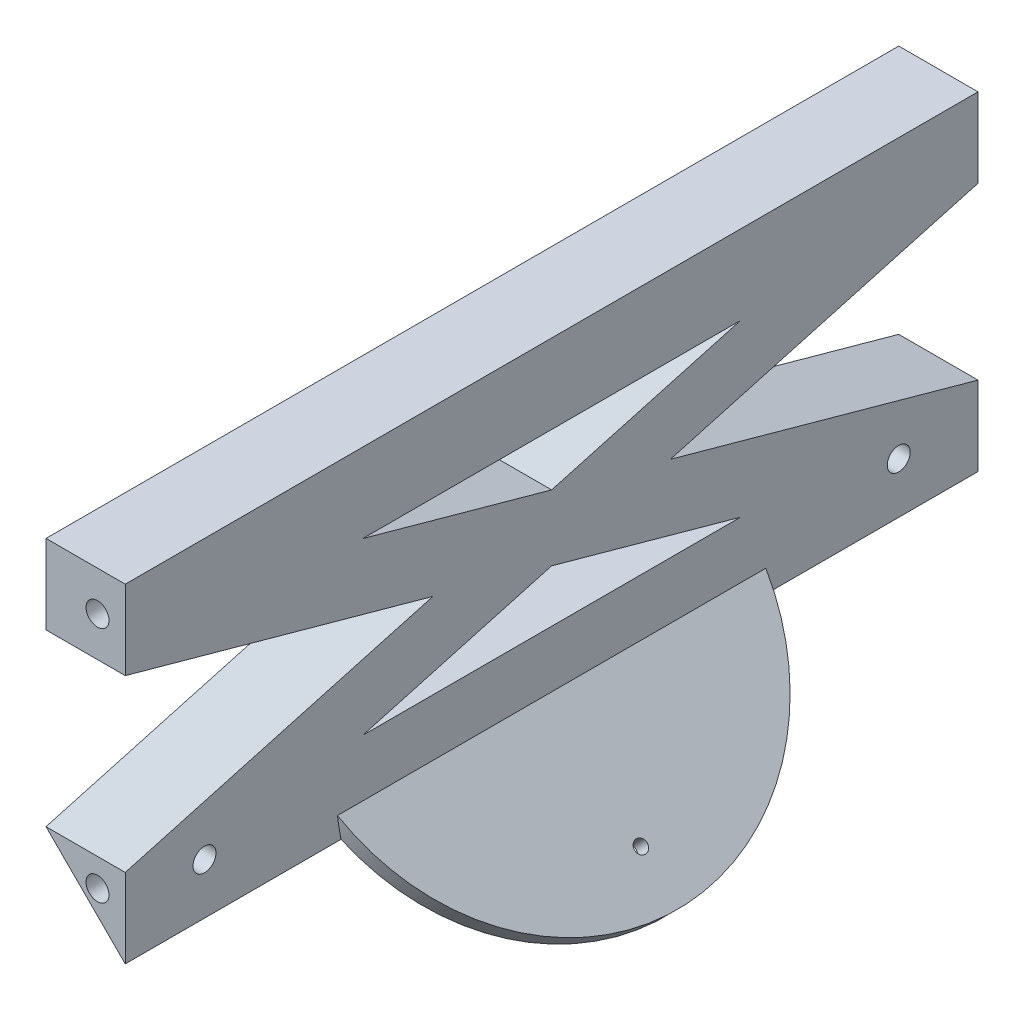
from build123d import *

# Parameters (mm, degrees)
MAIN_BODY_DEPTH        = 53.8
SKETCH4_W              = 35
SKETCH4_H              = 10.428932188
SKETCH4_H_2            = 14.142135624
BOSS_EXTRUDE2_DEPTH    = 2
M2X0_4_TAPPED_HOLE2_D  = 1.6
SIDE_HOLES_D           = 2.9
FILLET1_R              = 0.5
BOSS_EXTRUDE4_START    = -10
BOSS_EXTRUDE4_DEPTH    = 10
M2_5_CLEARANCE_HOLE1_D = 2.9
M2_5_CLEARANCE_HOLE2_D = 2.9


# Read off the part's stored shape, not the designer's step: Boss-Extrude4
with BuildPart() as part:
    # Sketch1 → Main Body (new, symmetric)
    with BuildSketch(Plane.XY):
        Polygon((-7.5, 2.5), (2.5, 2.5), (2.5, -7.5), align=None)
    extrude(amount=MAIN_BODY_DEPTH, both=True)

    # Sketch4 → Boss-Extrude2 (add)
    with BuildSketch(Plane(origin=(-2.5, -2.5, 0), x_dir=(0, 0, 1), z_dir=(-0.7071067811865474, -0.7071067811865477, 0))):
        with Locations((0, 12.285533906)):
            Rectangle(SKETCH4_W, SKETCH4_H)
        Rectangle(SKETCH4_W, SKETCH4_H_2)
        with Locations((0, -12.285533906)):
            Rectangle(SKETCH4_W, SKETCH4_H)
        with BuildLine():
            Line((-17.5, -17.5), (-17.5, -7.071067812))
            Line((-17.5, -7.071067812), (-26.575364532, -7.071067812))
            ThreePointArc((-26.575364532, -7.071067812), (0, -27.5), (26.575364532, -7.071067812))
            Line((26.575364532, -7.071067812), (17.5, -7.071067812))
            Line((17.5, -7.071067812), (17.5, -17.5))
            Line((17.5, -17.5), (-17.5, -17.5))
        make_face()
        with BuildLine():
            Line((-17.5, -7.071067812), (-17.5, 7.071067812))
            Line((-17.5, 7.071067812), (-26.575364532, 7.071067812))
            ThreePointArc((-26.575364532, 7.071067812), (-27.5, 0), (-26.575364532, -7.071067812))
            Line((-26.575364532, -7.071067812), (-17.5, -7.071067812))
        make_face()
        with BuildLine():
            Line((-17.5, 7.071067812), (-17.5, 17.5))
            Line((-17.5, 17.5), (17.5, 17.5))
            Line((17.5, 17.5), (17.5, 7.071067812))
            Line((17.5, 7.071067812), (26.575364532, 7.071067812))
            ThreePointArc((26.575364532, 7.071067812), (0, 27.5), (-26.575364532, 7.071067812))
            Line((-26.575364532, 7.071067812), (-17.5, 7.071067812))
        make_face()
        with BuildLine():
            Line((26.575364532, 7.071067812), (17.5, 7.071067812))
            Line((17.5, 7.071067812), (17.5, -7.071067812))
            Line((17.5, -7.071067812), (26.575364532, -7.071067812))
            ThreePointArc((26.575364532, -7.071067812), (27.267861345, -3.565632859), (27.5, 0))
            ThreePointArc((27.5, 0), (27.267861345, 3.565632859), (26.575364532, 7.071067812))
        make_face()
    extrude(amount=-BOSS_EXTRUDE2_DEPTH)

    # M2x0.4 Tapped Hole2 (through all)
    with Locations(Plane(origin=(-2.5, -2.5, 0), x_dir=(-0.7071067811865477, 0.7071067811865474, 0), z_dir=(-0.7071067811865474, -0.7071067811865477, 0))):
        with Locations((-21, 0), (14, 21), (14, -21)):
            Hole(M2X0_4_TAPPED_HOLE2_D / 2)

    # Side holes (through all)
    with Locations(Plane.XY.offset(53.8)):
        with Locations((-1, -1)):
            Hole(SIDE_HOLES_D / 2)

    # Sketch8 → Revolve1 (revolve)
    with BuildSketch(Plane(origin=(0, 0, 0), x_dir=(0, 0, 1), z_dir=(0.7071067811865476, -0.7071067811865476, 0)), mode=Mode.PRIVATE) as revolve1_sk:
        with BuildLine():
            Line((0, 3.535533906), (0, 4.535533906))
            ThreePointArc((0, 4.535533906), (-4.596194078, 6.439339828), (-6.5, 11.035533906))
            Line((-6.5, 11.035533906), (-12, 3.535533906))
            Line((-12, 3.535533906), (0, 3.535533906))
        make_face()
    revolve(revolve1_sk.sketch.rotate(Axis((-2.5, -2.5, 0), (-0.7071067811865476, -0.7071067811865476, 0)), 270), axis=Axis((-2.5, -2.5, 0), (-0.7071067811865476, -0.7071067811865476, 0)))

    # Fillet1
    fillet1_edges = [part.edges().sort_by_distance(p)[0] for p in [
        (-3.207106781, -12.399494937, 0),
    ]]
    fillet(fillet1_edges, radius=FILLET1_R)

    # Boss-Extrude4 outline → Boss-Extrude4 (add)
    with BuildSketch(Plane(origin=(2.5, 0, 0), x_dir=(0, 0, -1), z_dir=(1, 0, 0)).offset(BOSS_EXTRUDE4_START)):
        Polygon((53.8, 33.99997125), (-53.8, 33.99997125), (-53.8, 23.99997125), (-14.986093738, 13.249985625), (-53.8, 2.5), (-23.827812525, 2.5), (0, 9.099403842), (23.827812525, 2.5), (53.8, 2.5), (14.986093738, 13.249985625), (53.8, 23.99997125), align=None)
        Polygon((23.827812525, 23.99997125), (0, 17.400567408), (-23.827812525, 23.99997125), align=None, mode=Mode.SUBTRACT)
    extrude(amount=BOSS_EXTRUDE4_DEPTH)

    # M2.5 Clearance Hole1 (through all)
    with Locations(Plane.XY.offset(53.8)):
        with Locations((-1, 28.99997125)):
            Hole(M2_5_CLEARANCE_HOLE1_D / 2)

    # M2.5 Clearance Hole2 (through all)
    with Locations(Plane(origin=(2.5, 0, 0), x_dir=(0, 0, -1), z_dir=(1, 0, 0))):
        with Locations((-43.8, -1.085786438), (43.8, -1.085786438)):
            Hole(M2_5_CLEARANCE_HOLE2_D / 2)


solid = part.part
